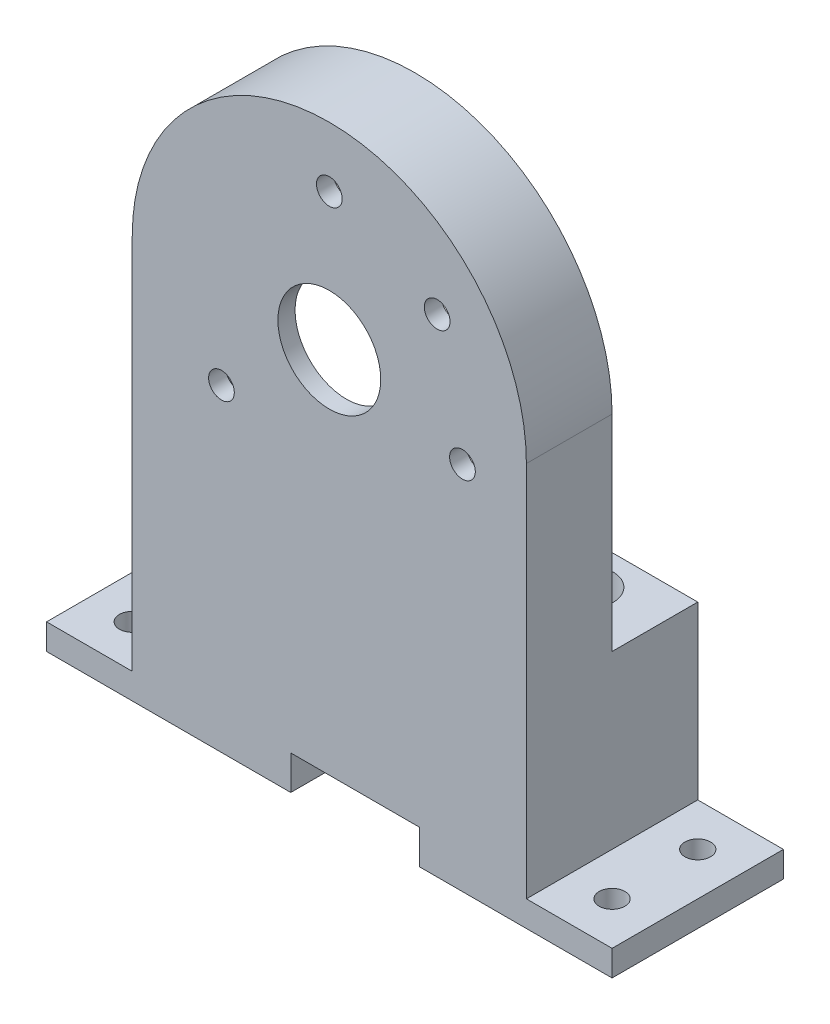
from build123d import *

# Parameters (mm, degrees)
EXTRUDE_1_DEPTH      = 20
CUT_EXTRUDE_1_DEPTH  = 10
SKETCH_3_R           = 21
CUT_EXTRUDE_2_DEPTH  = 8
SKETCH_7_R           = 1.5
CUT_EXTRUDE_6_DEPTH  = 3
SKETCH_8_R           = 6
CUT_EXTRUDE_7_DEPTH  = 3
SKETCH_12_W          = 46
SKETCH_12_H          = 20
EXTRUDE_4_DEPTH      = 20
SKETCH_13_R          = 3.1
CUT_EXTRUDE_8_DEPTH  = 20
SKETCH_14_W          = 10
SKETCH_14_H          = 20
SKETCH_14_R          = 1.5
EXTRUDE_5_DEPTH      = 3
SKETCH_15_R          = 1.5
CUT_EXTRUDE_9_DEPTH  = 78.31752712
SKETCH_16_W          = 15
SKETCH_16_H          = 20
CUT_EXTRUDE_10_DEPTH = 4


with BuildPart() as part:
    # 草图1 → 凸台-拉伸1 (new body)
    with BuildSketch(Plane.XY):
        with BuildLine():
            Line((-23, 0), (-23, -27))
            Line((-23, -27), (23, -27))
            Line((23, -27), (23, 0))
            ThreePointArc((23, 0), (0, 23), (-23, 0))
        make_face()
    extrude(amount=EXTRUDE_1_DEPTH)

    # 草图2 → 切除-拉伸1 (cut)
    with BuildSketch(Plane(origin=(0, 0, 0), x_dir=(-1, 0, 0), z_dir=(0, 0, -1))):
        with BuildLine():
            Line((-23, -24), (23, -24))
            Line((23, -24), (23, 0))
            ThreePointArc((23, 0), (0, 23), (-23, 0))
            Line((-23, 0), (-23, -24))
        make_face()
    extrude(amount=-CUT_EXTRUDE_1_DEPTH, mode=Mode.SUBTRACT)

    # 草图3 → 切除-拉伸2 (cut)
    with BuildSketch(Plane(origin=(0, 0, 10), x_dir=(-1, 0, 0), z_dir=(0, 0, -1))):
        Circle(SKETCH_3_R)
    extrude(amount=-CUT_EXTRUDE_2_DEPTH, mode=Mode.SUBTRACT)

    # 草图7 → 切除-拉伸6 (cut)
    with BuildSketch(Plane.XY.offset(20)):
        with Locations((0, 16)):
            Circle(SKETCH_7_R)
        with Locations((12.589057749, 9.875)):
            Circle(SKETCH_7_R)
        with Locations((-12.589057749, -9.875)):
            Circle(SKETCH_7_R)
        with Locations((15.539618159, -3.810546875)):
            Circle(SKETCH_7_R)
    extrude(amount=-CUT_EXTRUDE_6_DEPTH, mode=Mode.SUBTRACT)

    # 草图8 → 切除-拉伸7 (cut)
    with BuildSketch(Plane(origin=(0, 0, 18), x_dir=(-1, 0, 0), z_dir=(0, 0, -1))):
        Circle(SKETCH_8_R)
    extrude(amount=-CUT_EXTRUDE_7_DEPTH, mode=Mode.SUBTRACT)

    # 草图12 → 凸台-拉伸4 (add)
    with BuildSketch(Plane.XZ.offset(27)):
        with Locations((0, 10)):
            Rectangle(SKETCH_12_W, SKETCH_12_H)
    extrude(amount=EXTRUDE_4_DEPTH)

    # 草图13 → 切除-拉伸8 (cut)
    with BuildSketch(Plane(origin=(0, -24, 0), x_dir=(1, 0, 0), z_dir=(0, 1, 0))):
        with Locations((15, -5)):
            Circle(SKETCH_13_R)
        with Locations((-15, -5)):
            Circle(SKETCH_13_R)
    extrude(amount=-CUT_EXTRUDE_8_DEPTH, mode=Mode.SUBTRACT)

    # 草图14 → 凸台-拉伸5 (add)
    # profile 1 of 2: a face of its own
    with BuildSketch(Plane.XZ.offset(47)):
        with Locations((28, 10)):
            Rectangle(SKETCH_14_W, SKETCH_14_H)
        with Locations((28, 5)):
            Circle(SKETCH_14_R, mode=Mode.SUBTRACT)
        with Locations((28, 15)):
            Circle(SKETCH_14_R, mode=Mode.SUBTRACT)
    # profile 2 of 2: a face of its own
    with BuildSketch(Plane.XZ.offset(47)):
        with Locations((-28, 10)):
            Rectangle(SKETCH_14_W, SKETCH_14_H)
        with Locations((-28, 5)):
            Circle(SKETCH_14_R, mode=Mode.SUBTRACT)
        with Locations((-28, 15)):
            Circle(SKETCH_14_R, mode=Mode.SUBTRACT)
    extrude(amount=-EXTRUDE_5_DEPTH)

    # 草图15 → 切除-拉伸9 (cut, through all)
    with BuildSketch(Plane(origin=(0, -44, 0), x_dir=(1, 0, 0), z_dir=(0, 1, 0))):
        with Locations((-15, -5)):
            Circle(SKETCH_15_R)
        with Locations((15, -5)):
            Circle(SKETCH_15_R)
    extrude(amount=-CUT_EXTRUDE_9_DEPTH, mode=Mode.SUBTRACT)

    # 草图16 → 切除-拉伸10 (cut)
    with BuildSketch(Plane.XZ.offset(47)):
        with Locations((3, 10)):
            Rectangle(SKETCH_16_W, SKETCH_16_H)
    extrude(amount=-CUT_EXTRUDE_10_DEPTH, mode=Mode.SUBTRACT)


solid = part.part
